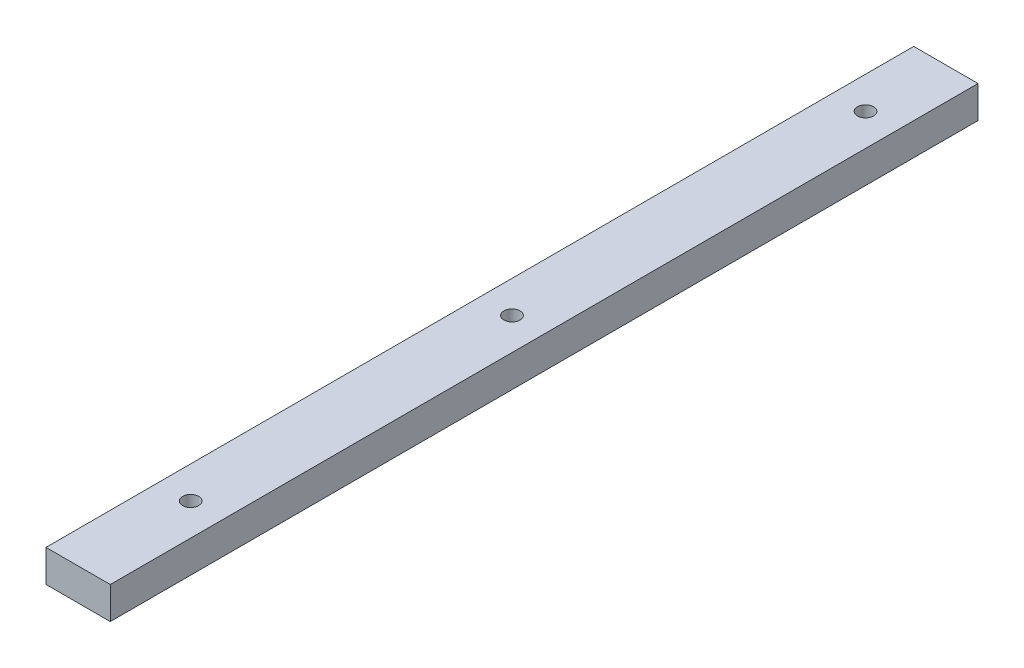
from build123d import *

# Parameters (mm, degrees)
SKETCH1_W           = 50.8
SKETCH1_H           = 25.4
BOSS_EXTRUDE1_DEPTH = 685.8
SKETCH2_R           = 6.35
CUT_EXTRUDE1_DEPTH  = 254


with BuildPart() as part:
    # Sketch1 → Boss-Extrude1 (new body)
    with BuildSketch(Plane.XY):
        with Locations((25.4, 12.7)):
            Rectangle(SKETCH1_W, SKETCH1_H)
    extrude(amount=BOSS_EXTRUDE1_DEPTH)

    # Sketch2 → Cut-Extrude1 (cut)
    with BuildSketch(Plane(origin=(0, 25.4, 0), x_dir=(1, 0, 0), z_dir=(0, 1, 0))):
        with Locations((25.4, -63.5)):
            Circle(SKETCH2_R)
        with Locations((25.4, -596.9)):
            Circle(SKETCH2_R)
        with Locations((25.4, -342.9)):
            Circle(SKETCH2_R)
    extrude(amount=-CUT_EXTRUDE1_DEPTH, mode=Mode.SUBTRACT)


solid = part.part
